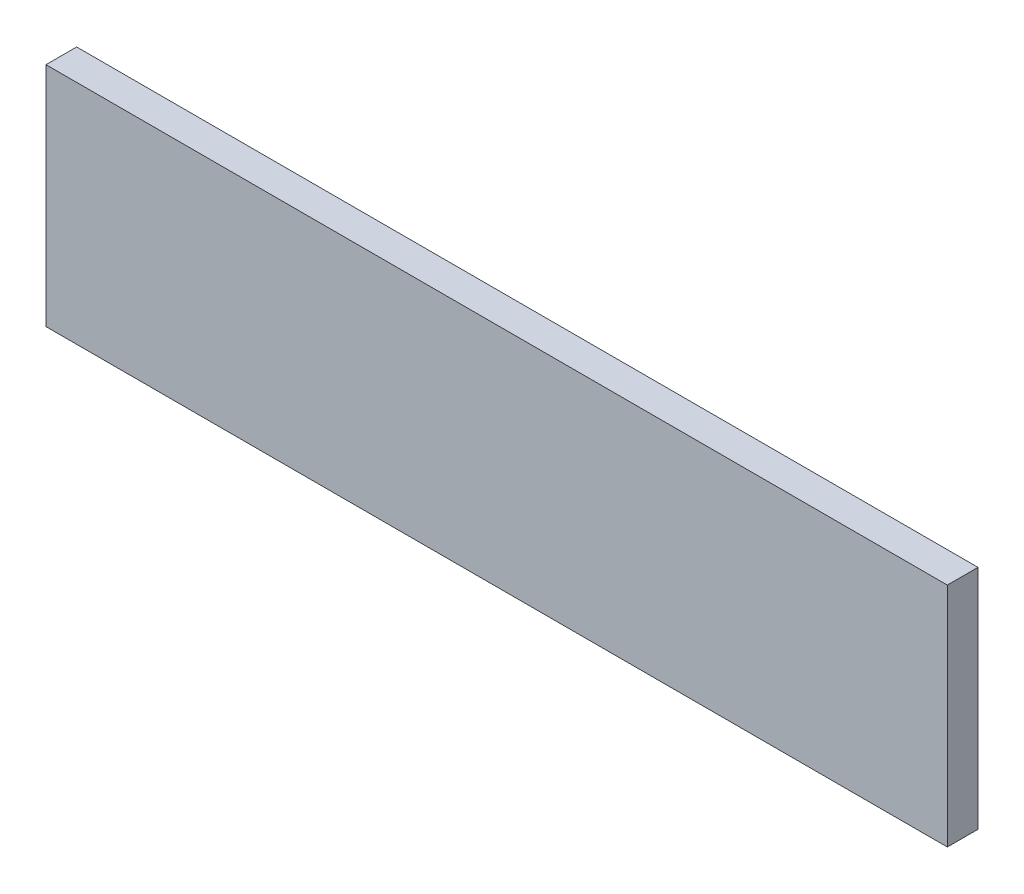
from build123d import *

# Parameters (mm, degrees)
SKETCH1_W           = 294
SKETCH1_H           = 74
BOSS_EXTRUDE1_DEPTH = 10


with BuildPart() as part:
    # Sketch1 → Boss-Extrude1 (new body)
    with BuildSketch(Plane.XY):
        with Locations((80, 30)):
            Rectangle(SKETCH1_W, SKETCH1_H)
    extrude(amount=BOSS_EXTRUDE1_DEPTH)


solid = part.part
